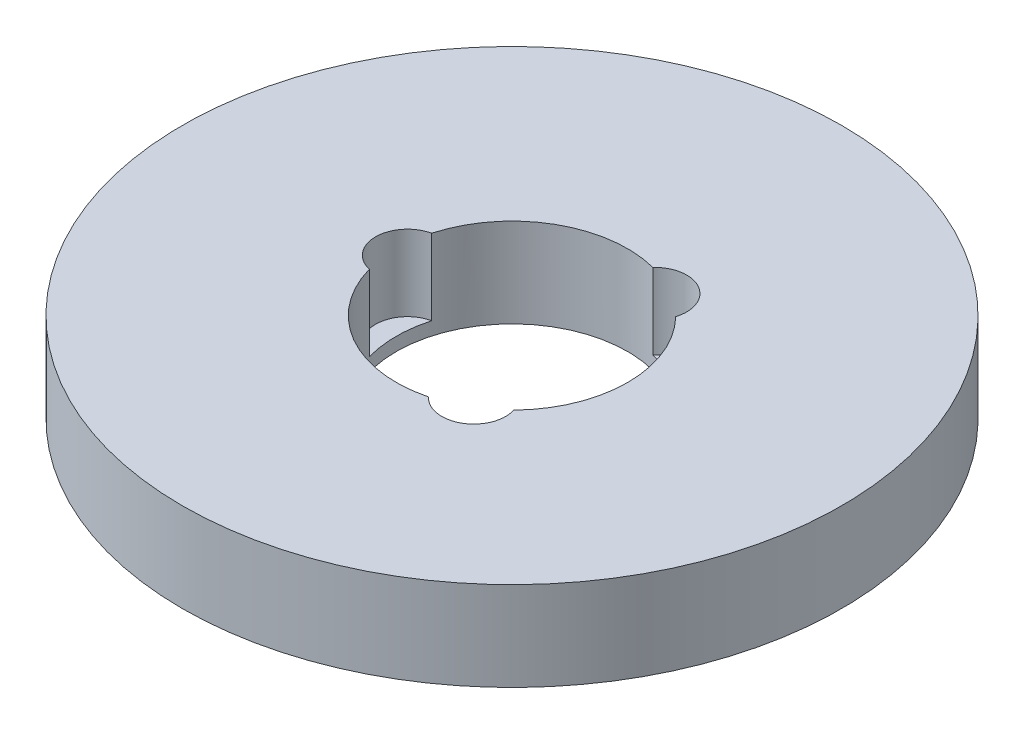
from build123d import *

# Parameters (mm, degrees)
SKETCH1_R           = 92.5
BOSS_EXTRUDE1_DEPTH = 25
SKETCH2_R           = 32.5
CUT_EXTRUDE1_DEPTH  = 134.182206019
SKETCH3_R           = 8.981538897
CUT_EXTRUDE2_DEPTH  = 21.273495115
CIRPATTERN1_COUNT   = 3


with BuildPart() as part:
    # Sketch1 → Boss-Extrude1 (new body)
    with BuildSketch(Plane(origin=(0, 0, 0), x_dir=(1, 0, 0), z_dir=(0, 1, 0))):
        Circle(SKETCH1_R)
    extrude(amount=BOSS_EXTRUDE1_DEPTH)

    # Sketch2 → Cut-Extrude1 (cut, through all)
    with BuildSketch(Plane(origin=(0, 0, 0), x_dir=(1, 0, 0), z_dir=(0, 1, 0))):
        Circle(SKETCH2_R)
    extrude(amount=CUT_EXTRUDE1_DEPTH, mode=Mode.SUBTRACT)

    # Sketch3 → Cut-Extrude2 (cut)
    with BuildSketch(Plane(origin=(0, 25, 0), x_dir=(1, 0, 0), z_dir=(0, 1, 0))):
        with Locations((-29.323063572, 0)):
            Circle(SKETCH3_R)
    cut_extrude2 = extrude(amount=-CUT_EXTRUDE2_DEPTH, mode=Mode.SUBTRACT)

    # CirPattern1: Cut-Extrude2 ×3 about axis
    cirpattern1_axis = Axis((0, 0, 0), (0, 1, 0))
    for i in range(1, CIRPATTERN1_COUNT):
        add(cut_extrude2.rotate(cirpattern1_axis, i * 360 / CIRPATTERN1_COUNT), mode=Mode.SUBTRACT)


solid = part.part
